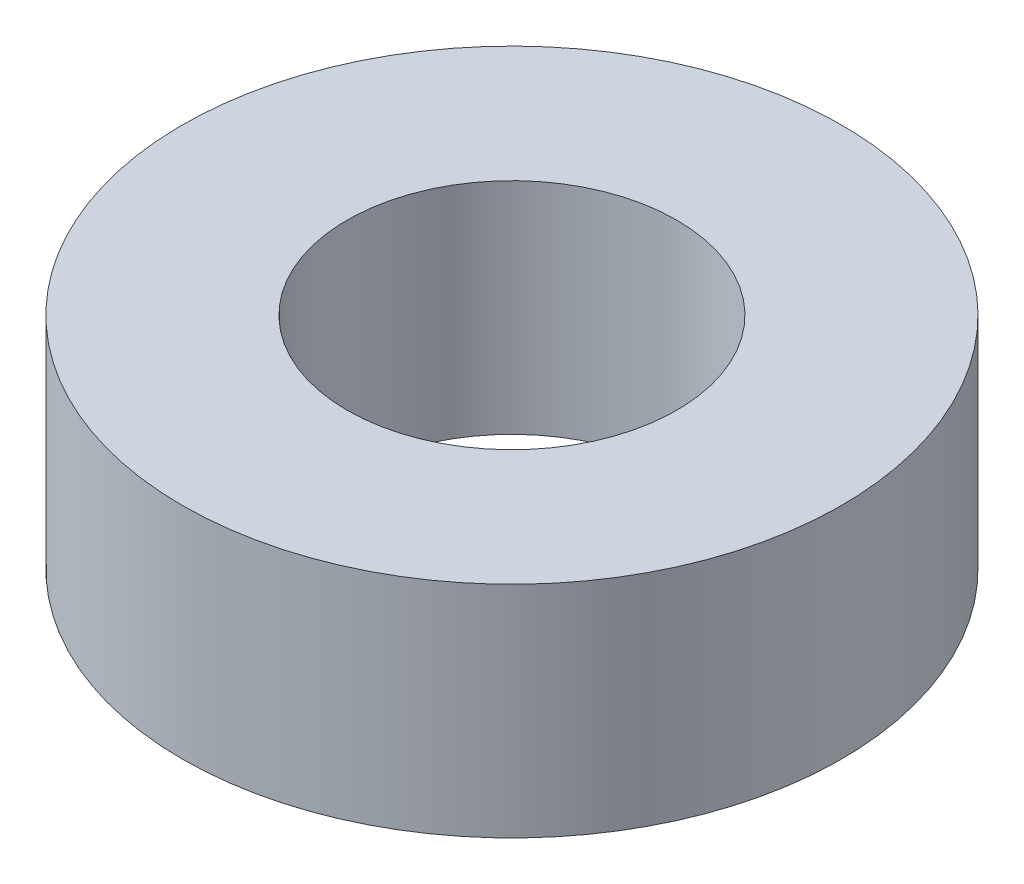
from build123d import *

# Parameters (mm, degrees)
SKETCH1_R           = 45
BOSS_EXTRUDE1_DEPTH = 30
SKETCH2_R           = 22.5
CUT_EXTRUDE1_DEPTH  = 71.356236397


with BuildPart() as part:
    # Sketch1 → Boss-Extrude1 (new body)
    with BuildSketch(Plane(origin=(0, 0, 0), x_dir=(1, 0, 0), z_dir=(0, 1, 0))):
        Circle(SKETCH1_R)
    extrude(amount=BOSS_EXTRUDE1_DEPTH)

    # Sketch2 → Cut-Extrude1 (cut, through all)
    with BuildSketch(Plane(origin=(0, 0, 0), x_dir=(1, 0, 0), z_dir=(0, 1, 0))):
        Circle(SKETCH2_R)
    extrude(amount=CUT_EXTRUDE1_DEPTH, mode=Mode.SUBTRACT)


solid = part.part
